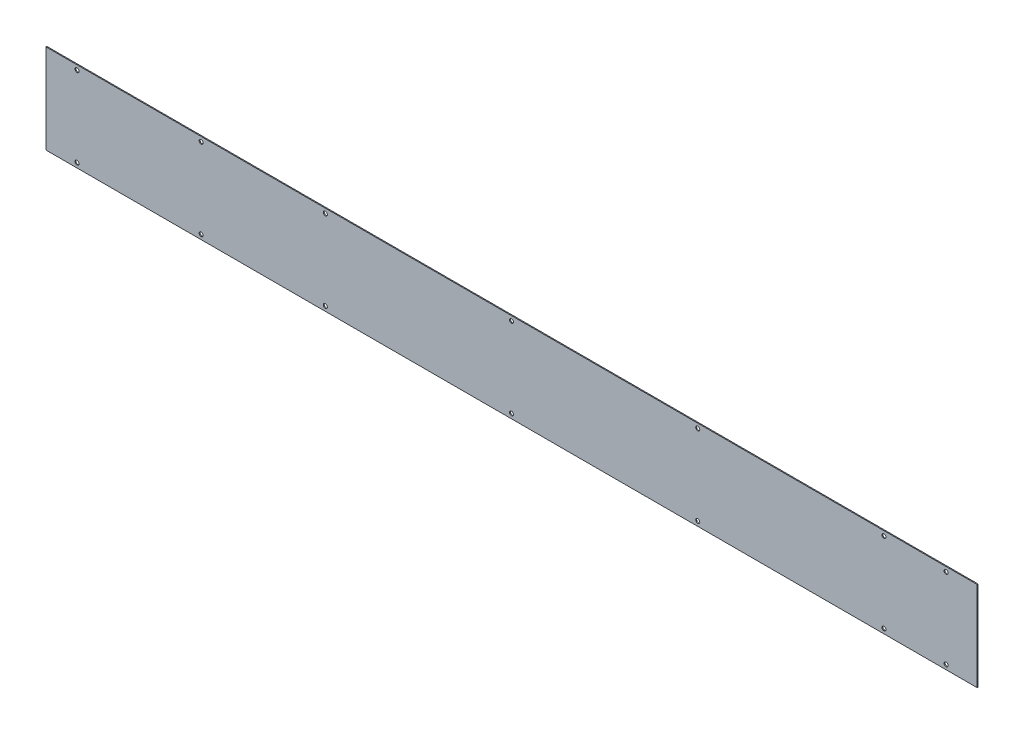
from build123d import *

# Parameters (mm, degrees)
SKETCH2_W          = 762
SKETCH2_H          = 73.152
BASE_FLANGE1_DEPTH = 0.75946
SKETCH13_R         = 1.651
CUT_EXTRUDE1_DEPTH = 383.752374983


# Sheet-metal steps are written as plain solids
with BuildPart() as part:
    # Sketch2 → Base-Flange1 (new body)
    with BuildSketch(Plane.XY):
        Rectangle(SKETCH2_W, SKETCH2_H)
    extrude(amount=-BASE_FLANGE1_DEPTH)

    # Sketch13 → Cut-Extrude1 (cut, through all)
    with BuildSketch(Plane.XY):
        with Locations((-254, 32.766)):
            Circle(SKETCH13_R)
        with Locations((-254, -32.766)):
            Circle(SKETCH13_R)
        with Locations((0, 32.766)):
            Circle(SKETCH13_R)
        with Locations((304.8, 32.766)):
            Circle(SKETCH13_R)
        with Locations((304.8, -32.766)):
            Circle(SKETCH13_R)
        with Locations((0, -32.766)):
            Circle(SKETCH13_R)
        with Locations((355.6, 32.766)):
            Circle(SKETCH13_R)
        with Locations((355.6, -32.766)):
            Circle(SKETCH13_R)
        with Locations((152.4, 32.766)):
            Circle(SKETCH13_R)
        with Locations((152.4, -32.766)):
            Circle(SKETCH13_R)
        with Locations((-152.4, 32.766)):
            Circle(SKETCH13_R)
        with Locations((-152.4, -32.766)):
            Circle(SKETCH13_R)
        with Locations((-355.6, 32.766)):
            Circle(SKETCH13_R)
        with Locations((-355.6, -32.766)):
            Circle(SKETCH13_R)
    extrude(amount=-CUT_EXTRUDE1_DEPTH, mode=Mode.SUBTRACT)


solid = part.part
